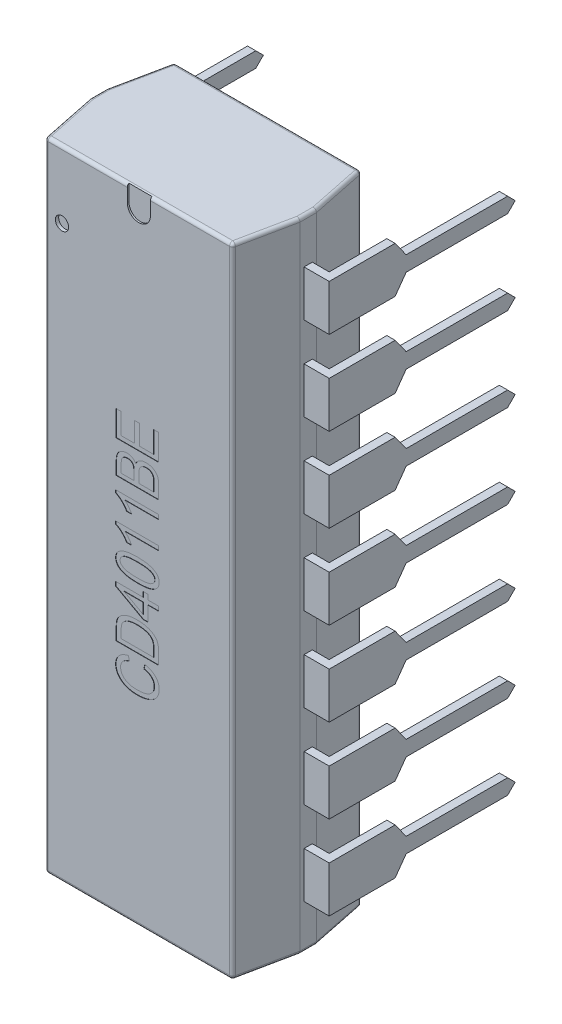
from build123d import *

# Parameters (mm, degrees)
IC_BODY_DEPTH              = 9.65
IC_BODY_DEPTH_BACK         = 9.65
FILLET6_R                  = 0.1
EXTRUDE_PINS_DEPTH         = 0.125
EXTRUDE_START              = -1.39
SKETCH32_W                 = 0.51
SKETCH32_H                 = 0.25
EXTRUDE_PINS_TO_BODY_DEPTH = 1.39
LPATTERN1_COUNT            = 4
LPATTERN1_PITCH            = 2.54
LPATTERN1_COL_COUNT        = 4
LPATTERN1_COL_PITCH        = 2.54
MIRROR1_START              = 3.685
MIRROR1_DEPTH              = 0.25
MIRROR1_START_2            = 3.175
MIRROR1_2_OUTLINE_W        = 1.39
MIRROR1_2_OUTLINE_H        = 0.25
MIRROR1_2_DEPTH            = 0.51
CUT_IC_LOCATOR_DEPTH       = 0.05
SKETCH24_R                 = 0.2
CUT_PIN_1_ID_DEPTH         = 0.1
CUT_NAME_DEPTH             = 0.01


# Read off the part's stored shape, not the designer's step: Mirror1
with BuildPart() as part:
    # Sketch11 → IC Body (new, two sides: drawn at the far end of the back side and taken through both)
    with BuildSketch(Plane(origin=(0, 0, 0), x_dir=(1, 0, 0), z_dir=(0, 1, 0)).offset(-IC_BODY_DEPTH_BACK)):
        Polygon((-2.825, 0), (2.825, 0), (3.175, -1.7), (3.175, -2.2), (2.825, -3.9), (-2.825, -3.9), (-3.175, -2.2), (-3.175, -1.7), align=None)
    extrude(amount=IC_BODY_DEPTH + IC_BODY_DEPTH_BACK)

    # Fillet6
    fillet6_edges = [part.edges().sort_by_distance(p)[0] for p in [
        (-3, -9.65, 3.05),
        (-2.825, 0, 0),
        (2.825, 0, 0),
        (2.825, 0, 3.9),
        (-2.825, 0, 3.9),
        (0, -9.65, 3.9),
        (3, -9.65, 3.05),
        (-3, 9.65, 0.85),
        (-3.175, 9.65, 1.95),
        (-3, 9.65, 3.05),
        (0, 9.65, 3.9),
        (3, 9.65, 3.05),
        (3.175, -9.65, 1.95),
        (3.175, 9.65, 1.95),
        (3, 9.65, 0.85),
        (0, 9.65, 0),
        (3, -9.65, 0.85),
        (0, -9.65, 0),
        (-3, -9.65, 0.85),
        (-3.175, -9.65, 1.95),
    ]]
    fillet(fillet6_edges, radius=FILLET6_R)



with BuildPart() as body_2:
    # Sketch31 → Extrude Pins (new, symmetric)
    with BuildSketch(Plane(origin=(-3.81, 0, 0), x_dir=(0, 0, -1), z_dir=(1, 0, 0))):
        Polygon((3.324, -0.23), (3.554, 0), (3.324, 0.23), (0.254, 0.23), (-0.079834708, 0.695), (-2.075, 0.695), (-2.075, -0.695), (-0.079834708, -0.695), (0.254, -0.23), align=None)
    extrude_pins = extrude(amount=EXTRUDE_PINS_DEPTH, both=True)


with BuildPart() as part_1:
    add(part.part)

    add(body_2.part)  # Extrude Pins to Body merges body 2
    # Sketch32 → Extrude Pins to Body (add)
    with BuildSketch(Plane(origin=(0, 0.695, 0), x_dir=(1, 0, 0), z_dir=(0, 1, 0)).offset(EXTRUDE_START)):
        with Locations((-3.43, -1.95)):
            Rectangle(SKETCH32_W, SKETCH32_H)
    extrude_pins_to_body = extrude(amount=EXTRUDE_PINS_TO_BODY_DEPTH)

    # LPattern1: Extrude Pins, Extrude Pins to Body ×4
    with Locations(*[(0, i * LPATTERN1_PITCH, 0) for i in range(1, LPATTERN1_COUNT)]):
        add(extrude_pins)
        add(extrude_pins_to_body)


with BuildPart() as lpattern1_col_1:
    # LPattern1 col: Extrude Pins, Extrude Pins to Body ×4
    with Locations(*[(0, -i * LPATTERN1_COL_PITCH, 0) for i in range(1, LPATTERN1_COL_COUNT)]):
        add(extrude_pins)
        add(extrude_pins_to_body)


with BuildPart() as part_2:
    add(part_1.part)

    # LPattern1 col united with what the copie: union LPattern1 col_1
    add(lpattern1_col_1.part)



with BuildPart() as body_2_2:
    # Mirror1 outline → Mirror1 (new body)
    with BuildSketch(Plane.YZ.offset(MIRROR1_START)):
        Polygon((-0.695, 2.075), (-0.695, 0.079834708), (-0.23, -0.254), (-0.23, -3.324), (0, -3.554), (0.23, -3.324), (0.23, -0.254), (0.695, 0.079834708), (0.695, 2.075), align=None)
        Polygon((1.845, 2.075), (1.845, 0.079834708), (2.31, -0.254), (2.31, -3.324), (2.54, -3.554), (2.77, -3.324), (2.77, -0.254), (3.235, 0.079834708), (3.235, 2.075), align=None)
        Polygon((4.385, 2.075), (4.385, 0.079834708), (4.85, -0.254), (4.85, -3.324), (5.08, -3.554), (5.31, -3.324), (5.31, -0.254), (5.775, 0.079834708), (5.775, 2.075), align=None)
        Polygon((6.925, 2.075), (6.925, 0.079834708), (7.39, -0.254), (7.39, -3.324), (7.62, -3.554), (7.85, -3.324), (7.85, -0.254), (8.315, 0.079834708), (8.315, 2.075), align=None)
        Polygon((-3.235, 2.075), (-3.235, 0.079834708), (-2.77, -0.254), (-2.77, -3.324), (-2.54, -3.554), (-2.31, -3.324), (-2.31, -0.254), (-1.845, 0.079834708), (-1.845, 2.075), align=None)
        Polygon((-5.775, 2.075), (-5.775, 0.079834708), (-5.31, -0.254), (-5.31, -3.324), (-5.08, -3.554), (-4.85, -3.324), (-4.85, -0.254), (-4.385, 0.079834708), (-4.385, 2.075), align=None)
        Polygon((-8.315, 2.075), (-8.315, 0.079834708), (-7.85, -0.254), (-7.85, -3.324), (-7.62, -3.554), (-7.39, -3.324), (-7.39, -0.254), (-6.925, 0.079834708), (-6.925, 2.075), align=None)
    extrude(amount=MIRROR1_DEPTH)


with BuildPart() as part_3:
    add(part_2.part)

    add(body_2_2.part)  # Mirror1 2 merges body 2 2
    # Mirror1 2 outline → Mirror1 2 (add)
    with BuildSketch(Plane.YZ.offset(MIRROR1_START_2)):
        with Locations((0, 1.95)):
            Rectangle(MIRROR1_2_OUTLINE_W, MIRROR1_2_OUTLINE_H)
        with Locations((2.54, 1.95)):
            Rectangle(MIRROR1_2_OUTLINE_W, MIRROR1_2_OUTLINE_H)
        with Locations((5.08, 1.95)):
            Rectangle(MIRROR1_2_OUTLINE_W, MIRROR1_2_OUTLINE_H)
        with Locations((7.62, 1.95)):
            Rectangle(MIRROR1_2_OUTLINE_W, MIRROR1_2_OUTLINE_H)
        with Locations((-2.54, 1.95)):
            Rectangle(MIRROR1_2_OUTLINE_W, MIRROR1_2_OUTLINE_H)
        with Locations((-5.08, 1.95)):
            Rectangle(MIRROR1_2_OUTLINE_W, MIRROR1_2_OUTLINE_H)
        with Locations((-7.62, 1.95)):
            Rectangle(MIRROR1_2_OUTLINE_W, MIRROR1_2_OUTLINE_H)
    extrude(amount=MIRROR1_2_DEPTH)

    # Sketch25 → Cut IC Locator (cut)
    with BuildSketch(Plane.XY.offset(3.9)):
        with BuildLine():
            Line((0.35, 9.65), (0.35, 9.15))
            ThreePointArc((0.35, 9.15), (0, 8.8), (-0.35, 9.15))
            Line((-0.35, 9.15), (-0.35, 9.65))
            Line((-0.35, 9.65), (0.35, 9.65))
        make_face()
    extrude(amount=-CUT_IC_LOCATOR_DEPTH, mode=Mode.SUBTRACT)

    # Sketch24 → Cut -Pin 1 ID (cut)
    with BuildSketch(Plane.XY.offset(3.9)):
        with Locations((-2.325, 7.62)):
            Circle(SKETCH24_R)
    extrude(amount=-CUT_PIN_1_ID_DEPTH, mode=Mode.SUBTRACT)

    # Sketch33 → Cut-Name (cut)
    # profile 1 of 8: a face of its own
    with BuildSketch(Plane.XY.offset(3.9)):
        with BuildLine():
            Line((0.14971036, -2.818479596), (0.183065149, -2.685060443))
            add(Edge.make_bspline(
                [(0.183065149, -2.685060443), (0.200745702, -2.68903692), (0.235215407, -2.696789391), (0.284792985, -2.711332284), (0.33080895, -2.728319249), (0.37341885, -2.747314027), (0.412630347, -2.768333236), (0.448260494, -2.791647118), (0.480612243, -2.816933138), (0.509170771, -2.844660527), (0.534731317, -2.873914989), (0.556559158, -2.905013534), (0.575347355, -2.937547144), (0.590373959, -2.971755831), (0.602253739, -3.007424753), (0.610454338, -3.044722508), (0.615948306, -3.083503888), (0.616432361, -3.10996723), (0.616677394, -3.123363206)],
                knots=[0, 0, 0, 0, 1.289353086, 2.513700628, 3.673385124, 4.777321585, 5.831023157, 6.835648429, 7.803886002, 8.748111141, 9.663929382, 10.564264807, 11.447463292, 12.332994627, 13.21843967, 14.118159583, 15.047395907, 16, 16, 16, 16], degree=3))
            add(Edge.make_bspline(
                [(0.616677394, -3.123363206), (0.616514252, -3.135186292), (0.616194456, -3.158362316), (0.612579368, -3.19246904), (0.607298818, -3.225346511), (0.599348989, -3.256918778), (0.589616268, -3.287254786), (0.577118555, -3.316063839), (0.562888374, -3.343805925), (0.546097345, -3.370193722), (0.527012812, -3.395379338), (0.505164934, -3.419225592), (0.480674449, -3.441891579), (0.453289847, -3.463204231), (0.423745844, -3.483910018), (0.391110949, -3.502888635), (0.355929234, -3.520814591), (0.318294468, -3.537649232), (0.278506753, -3.553213385), (0.23649911, -3.565945659), (0.192985075, -3.57729481), (0.147632306, -3.586303745), (0.100627861, -3.593736403), (0.051717012, -3.598443311), (0.001136438, -3.601770029), (-0.033214037, -3.602132715), (-0.050678953, -3.602317116)],
                knots=[0, 0, 0, 0, 0.921073667, 1.805520506, 2.670265093, 3.514196551, 4.340540458, 5.150330323, 5.958760814, 6.76821105, 7.584651584, 8.418448886, 9.285522186, 10.182088649, 11.121025464, 12.095129432, 13.121488672, 14.19720655, 15.30730909, 16.448576387, 17.61598683, 18.810867686, 20.050753221, 21.323199669, 22.639026301, 24, 24, 24, 24], degree=3))
            add(Edge.make_bspline(
                [(-0.050678953, -3.602317116), (-0.067883456, -3.602134221), (-0.101626853, -3.601775507), (-0.151166324, -3.598454226), (-0.198780315, -3.593759333), (-0.244305389, -3.586300352), (-0.287939695, -3.577353516), (-0.329392662, -3.566045029), (-0.369005956, -3.553128453), (-0.406398496, -3.537766722), (-0.441608115, -3.520464367), (-0.474752715, -3.501946085), (-0.505878284, -3.482337734), (-0.534421694, -3.460652854), (-0.560987111, -3.437958845), (-0.585141576, -3.413486523), (-0.60700832, -3.387642796), (-0.626934153, -3.360567656), (-0.644208406, -3.332201835), (-0.65954765, -3.303122517), (-0.672275402, -3.273113018), (-0.682734249, -3.242282312), (-0.690864233, -3.210660345), (-0.696453985, -3.178235163), (-0.700396577, -3.145088434), (-0.70068915, -3.122680103), (-0.700836737, -3.111376329)],
                knots=[0, 0, 0, 0, 1.355026576, 2.657629592, 3.909672378, 5.122282177, 6.289750101, 7.416737124, 8.50507279, 9.569838826, 10.598010427, 11.593540646, 12.559644741, 13.492918072, 14.414658006, 15.309728197, 16.19807831, 17.079418121, 17.954841938, 18.811754048, 19.667052977, 20.519555819, 21.374197669, 22.235876869, 23.110096619, 24, 24, 24, 24], degree=3))
            add(Edge.make_bspline(
                [(-0.700836737, -3.111376329), (-0.700519757, -3.099030074), (-0.699897101, -3.074777838), (-0.695462825, -3.038971723), (-0.687599706, -3.004633047), (-0.676788171, -2.971528718), (-0.663355508, -2.939651936), (-0.646484388, -2.909244351), (-0.626584831, -2.880196497), (-0.603579712, -2.852608771), (-0.577816375, -2.826480828), (-0.5489949, -2.802435137), (-0.517238455, -2.780553631), (-0.482906213, -2.760448876), (-0.445522325, -2.74269286), (-0.405409445, -2.72699134), (-0.362553626, -2.712587071), (-0.332609199, -2.705414975), (-0.317256673, -2.701737837)],
                knots=[0, 0, 0, 0, 0.96928357, 1.904001914, 2.82717962, 3.730829761, 4.635277328, 5.538798787, 6.456240452, 7.39579775, 8.3554607, 9.333438427, 10.337996414, 11.380185464, 12.453917498, 13.583566383, 14.761092973, 16, 16, 16, 16], degree=3))
            Line((-0.317256673, -2.701737837), (-0.283901885, -2.83515699))
            add(Edge.make_bspline(
                [(-0.283901885, -2.83515699), (-0.294706521, -2.838172534), (-0.315778807, -2.844053752), (-0.346045034, -2.854519547), (-0.374244766, -2.865966246), (-0.40045414, -2.878406605), (-0.424445723, -2.892259953), (-0.446415026, -2.907121394), (-0.466423209, -2.923016366), (-0.484048381, -2.940278729), (-0.499951211, -2.95833397), (-0.51357446, -2.977735356), (-0.524955425, -2.998321801), (-0.534522511, -3.019907276), (-0.541718666, -3.042559994), (-0.547019163, -3.066354443), (-0.550145667, -3.091227376), (-0.550540448, -3.108240609), (-0.55074019, -3.116848599)],
                knots=[0, 0, 0, 0, 1.274827499, 2.486296693, 3.637698816, 4.732866786, 5.781146847, 6.783409552, 7.745577291, 8.681189198, 9.583979081, 10.476943643, 11.369744444, 12.253932728, 13.156290603, 14.066553906, 15.021756508, 16, 16, 16, 16], degree=3))
            add(Edge.make_bspline(
                [(-0.55074019, -3.116848599), (-0.550110709, -3.13383907), (-0.548882374, -3.166993399), (-0.538664922, -3.214944621), (-0.522321676, -3.259560461), (-0.502710899, -3.293517983), (-0.483900954, -3.318695019), (-0.467820656, -3.336542223), (-0.44986607, -3.353341918), (-0.430222396, -3.369323568), (-0.408733899, -3.384341615), (-0.385240687, -3.398235231), (-0.360072433, -3.411145911), (-0.333107051, -3.423294445), (-0.304163168, -3.433873887), (-0.273360858, -3.443235538), (-0.240764903, -3.451342699), (-0.206308168, -3.457830823), (-0.170022223, -3.462664473), (-0.131872986, -3.466388396), (-0.091872771, -3.468388609), (-0.064578744, -3.468726095), (-0.050678953, -3.468897964)],
                knots=[0, 0, 0, 0, 1.477150824, 2.882435776, 4.245666297, 5.596604592, 6.276856516, 6.977993226, 7.683799496, 8.414501263, 9.17983833, 9.962775894, 10.787606784, 11.640228058, 12.534608525, 13.467077939, 14.440493086, 15.455932091, 16.516312958, 17.624894552, 18.790450687, 20, 20, 20, 20], degree=3))
            add(Edge.make_bspline(
                [(-0.050678953, -3.468897964), (-0.029825673, -3.468568383), (0.010620803, -3.467929136), (0.069362279, -3.46385305), (0.124144666, -3.456721705), (0.174785343, -3.446252884), (0.221447266, -3.433321668), (0.264148285, -3.417588842), (0.302709124, -3.398458041), (0.337209999, -3.376602013), (0.367626009, -3.352215836), (0.394126518, -3.325904625), (0.416440785, -3.297502325), (0.434994461, -3.267353896), (0.449028206, -3.235010442), (0.459293647, -3.200926091), (0.465383207, -3.164839417), (0.466175773, -3.140150739), (0.466580848, -3.127532554)],
                knots=[0, 0, 0, 0, 1.437104972, 2.787371166, 4.055570009, 5.241294904, 6.348053785, 7.389870239, 8.372351441, 9.308936623, 10.198930124, 11.053953419, 11.87666206, 12.682560998, 13.486679433, 14.299132302, 15.130700221, 16, 16, 16, 16], degree=3))
            add(Edge.make_bspline(
                [(0.466580848, -3.127532554), (0.46632261, -3.118138705), (0.465813725, -3.099627098), (0.462008948, -3.072337125), (0.456134785, -3.045935743), (0.44748038, -3.020512066), (0.43617476, -2.996218037), (0.42256998, -2.972918601), (0.406499892, -2.950601564), (0.388112513, -2.929308745), (0.367117969, -2.909357762), (0.343503885, -2.891110443), (0.31750492, -2.874395357), (0.288770865, -2.859833394), (0.257667132, -2.846812417), (0.223991461, -2.835355839), (0.187768887, -2.825702107), (0.162600539, -2.820925814), (0.14971036, -2.818479596)],
                knots=[0, 0, 0, 0, 0.928238582, 1.829195527, 2.718541612, 3.598220604, 4.477899596, 5.362883569, 6.261136532, 7.192387853, 8.139765768, 9.118675424, 10.13801499, 11.190128329, 12.298336808, 13.468533125, 14.703488264, 16, 16, 16, 16], degree=3))
        make_face()
    # profile 2 of 8: a face of its own
    with BuildSketch(Plane.XY.offset(3.9)):
        with BuildLine():
            Line((0.6, -2.501609109), (-0.684159342, -2.501609109))
            Line((-0.684159342, -2.501609109), (-0.684159342, -2.139657541))
            add(Edge.make_bspline(
                [(-0.684159342, -2.139657541), (-0.684162657, -2.128797874), (-0.684169104, -2.107677811), (-0.682695507, -2.077101612), (-0.680979994, -2.048504494), (-0.678442728, -2.021981859), (-0.674930103, -1.997417521), (-0.671312709, -1.974807405), (-0.666232944, -1.954332901), (-0.662322386, -1.94151112), (-0.660446173, -1.935359464)],
                knots=[0, 0, 0, 0, 1.26215185, 2.454654178, 3.557482523, 4.592303098, 5.550444389, 6.441834679, 7.252420792, 8, 8, 8, 8], degree=3))
            add(Edge.make_bspline(
                [(-0.660446173, -1.935359464), (-0.654722803, -1.920386722), (-0.643272019, -1.890430657), (-0.617888391, -1.848862851), (-0.586202277, -1.810578126), (-0.548459989, -1.775285512), (-0.504723187, -1.743645353), (-0.455757566, -1.715385552), (-0.401426308, -1.691285464), (-0.341960161, -1.670578707), (-0.276843026, -1.654208754), (-0.205975572, -1.642713393), (-0.129433721, -1.635608197), (-0.07649308, -1.634801692), (-0.049115447, -1.634384618)],
                knots=[0, 0, 0, 0, 0.79354552, 1.587651966, 2.401682948, 3.25188975, 4.142718826, 5.072875711, 6.050348573, 7.085635456, 8.191960566, 9.375234215, 10.642633045, 12, 12, 12, 12], degree=3))
            add(Edge.make_bspline(
                [(-0.049115447, -1.634384618), (-0.031305519, -1.634603981), (0.003729438, -1.635035503), (0.055206956, -1.637857436), (0.104679438, -1.642817832), (0.15201442, -1.649728422), (0.19727823, -1.658996418), (0.240509145, -1.66971624), (0.281594461, -1.682910319), (0.320576679, -1.697667736), (0.357230143, -1.713983704), (0.391147566, -1.731700038), (0.422279111, -1.750536039), (0.450841704, -1.770237227), (0.476432103, -1.791382809), (0.499207075, -1.813660209), (0.519509236, -1.836839496), (0.53675253, -1.861602376), (0.551810421, -1.887770314), (0.564813373, -1.915659455), (0.575825134, -1.94554857), (0.584530384, -1.977411211), (0.591633572, -2.011068913), (0.596529653, -2.046682034), (0.59936226, -2.084193391), (0.599784262, -2.10985916), (0.6, -2.122980147)],
                knots=[0, 0, 0, 0, 1.386274685, 2.727022628, 4.011297765, 5.255271911, 6.448626978, 7.606323575, 8.720335122, 9.805243236, 10.849378986, 11.841293546, 12.781660028, 13.680063108, 14.539671463, 15.36201935, 16.157697919, 16.934245542, 17.70660244, 18.505119706, 19.326522077, 20.182800412, 21.073872178, 22.002301983, 22.978726542, 24, 24, 24, 24], degree=3))
            Line((0.6, -2.122980147), (0.6, -2.501609109))
        make_face()
        with BuildLine():
            Line((0.449903453, -2.368189956), (0.449903453, -2.139136372))
            add(Edge.make_bspline(
                [(0.449903453, -2.139136372), (0.449745809, -2.12792746), (0.449440012, -2.106184656), (0.447305191, -2.074623293), (0.444077619, -2.045100863), (0.439077164, -2.017703964), (0.432923081, -1.992429809), (0.425365241, -1.96920454), (0.416258395, -1.948113869), (0.405767363, -1.928782206), (0.393548639, -1.911198253), (0.380065785, -1.894606112), (0.36442144, -1.879548745), (0.347535941, -1.865151999), (0.328892387, -1.851808863), (0.308557089, -1.839506069), (0.286280998, -1.828667406), (0.27074173, -1.822188072), (0.262803939, -1.818878289)],
                knots=[0, 0, 0, 0, 1.342409423, 2.603976618, 3.787321799, 4.897425276, 5.936990894, 6.900926501, 7.818910418, 8.68490097, 9.530402278, 10.380244758, 11.240970118, 12.126792963, 13.036248329, 13.983649039, 14.970004749, 16, 16, 16, 16], degree=3))
            add(Edge.make_bspline(
                [(0.262803939, -1.818878289), (0.251638514, -1.814768969), (0.229072334, -1.806463718), (0.193878332, -1.795911302), (0.156973757, -1.787638286), (0.118537287, -1.780053846), (0.078469748, -1.774901593), (0.036786863, -1.770498767), (-0.006528689, -1.768271752), (-0.035997414, -1.767961223), (-0.050939537, -1.76780377)],
                knots=[0, 0, 0, 0, 0.893151802, 1.805128209, 2.755850574, 3.731738016, 4.745334486, 5.787480394, 6.878141491, 8, 8, 8, 8], degree=3))
            add(Edge.make_bspline(
                [(-0.050939537, -1.76780377), (-0.06683976, -1.767917721), (-0.097794411, -1.768139561), (-0.142901659, -1.770896986), (-0.1853663, -1.774843262), (-0.225169686, -1.780964413), (-0.262464544, -1.788330906), (-0.29709157, -1.797719755), (-0.329187862, -1.808636194), (-0.358588547, -1.821387285), (-0.38543715, -1.835575119), (-0.410108548, -1.850356185), (-0.432341191, -1.866290312), (-0.452293286, -1.883223416), (-0.469733189, -1.901350473), (-0.48533055, -1.920021407), (-0.498227269, -1.940051948), (-0.505099544, -1.954136048), (-0.508525536, -1.961157307)],
                knots=[0, 0, 0, 0, 1.456797099, 2.836101316, 4.139746769, 5.363373783, 6.524762118, 7.621480013, 8.64848053, 9.628833388, 10.554507815, 11.429517694, 12.262272889, 13.058269727, 13.823796696, 14.564721123, 15.284479333, 16, 16, 16, 16], degree=3))
            add(Edge.make_bspline(
                [(-0.508525536, -1.961157307), (-0.51061366, -1.966250017), (-0.515007437, -1.976965969), (-0.520045177, -1.994539358), (-0.524558661, -2.014087816), (-0.527716886, -2.035814123), (-0.530655553, -2.059518317), (-0.532769959, -2.085421681), (-0.533634218, -2.113419703), (-0.533917003, -2.132795259), (-0.534062796, -2.142784552)],
                knots=[0, 0, 0, 0, 0.715292366, 1.505100173, 2.373764653, 3.322734101, 4.358121183, 5.480036167, 6.700803291, 8, 8, 8, 8], degree=3))
            Line((-0.534062796, -2.142784552), (-0.534062796, -2.368189956))
            Line((-0.534062796, -2.368189956), (0.449903453, -2.368189956))
        make_face(mode=Mode.SUBTRACT)
    # profile 3 of 8: a face of its own
    with BuildSketch(Plane.XY.offset(3.9)):
        Polygon((0.6, -1.084030614), (0.283129513, -1.084030614), (0.283129513, -1.534320253), (0.133032966, -1.534320253), (-0.700836737, -1.07647367), (-0.700836737, -0.950611461), (0.133032966, -0.950611461), (0.133032966, -0.800514915), (0.283129513, -0.800514915), (0.283129513, -0.950611461), (0.6, -0.950611461), align=None)
        Polygon((0.133032966, -1.084030614), (-0.44728823, -1.084030614), (0.133032966, -1.402725191), align=None, mode=Mode.SUBTRACT)
    # profile 4 of 8: a face of its own
    with BuildSketch(Plane.XY.offset(3.9)):
        with BuildLine():
            add(Edge.make_bspline(
                [(-0.041558503, -0.667095762), (-0.067796635, -0.666883924), (-0.118744777, -0.666472586), (-0.192639119, -0.662220578), (-0.261673467, -0.655515751), (-0.325752508, -0.646392091), (-0.384895114, -0.634064437), (-0.439244057, -0.619461043), (-0.488647088, -0.601735077), (-0.533144162, -0.581549444), (-0.572562211, -0.558643794), (-0.606777208, -0.532940635), (-0.636070299, -0.504808577), (-0.659836391, -0.473671209), (-0.67826556, -0.440005086), (-0.691441995, -0.403739832), (-0.699413802, -0.364904667), (-0.700356, -0.338102628), (-0.700836737, -0.324427431)],
                knots=[0, 0, 0, 0, 1.522177082, 2.955701814, 4.292601031, 5.54555501, 6.7088804, 7.795771162, 8.808034672, 9.750647735, 10.627079958, 11.44753433, 12.228026558, 12.97593222, 13.711165822, 14.446140298, 15.20717461, 16, 16, 16, 16], degree=3))
            add(Edge.make_bspline(
                [(-0.700836737, -0.324427431), (-0.700483669, -0.312232826), (-0.69978987, -0.288269658), (-0.692919777, -0.253474742), (-0.682678253, -0.220481118), (-0.667564347, -0.189768639), (-0.648320177, -0.160989801), (-0.624646455, -0.134486565), (-0.597047187, -0.109573161), (-0.576118208, -0.095387673), (-0.56533291, -0.088077487)],
                knots=[0, 0, 0, 0, 1.02455918, 2.013323352, 2.972239719, 3.92313388, 4.881632631, 5.875512573, 6.905191138, 8, 8, 8, 8], degree=3))
            add(Edge.make_bspline(
                [(-0.56533291, -0.088077487), (-0.55081948, -0.079590508), (-0.520637271, -0.06194094), (-0.470066045, -0.040873253), (-0.413508768, -0.023059423), (-0.350908726, -0.008198908), (-0.282134059, 0.002590641), (-0.207463758, 0.011002951), (-0.126574714, 0.015906337), (-0.070576895, 0.016414211), (-0.041558503, 0.016677394)],
                knots=[0, 0, 0, 0, 0.745752227, 1.550870435, 2.425309485, 3.376577511, 4.404263406, 5.514061028, 6.71177208, 8, 8, 8, 8], degree=3))
            add(Edge.make_bspline(
                [(-0.041558503, 0.016677394), (-0.01549392, 0.016466671), (0.035107366, 0.016057576), (0.108565647, 0.011787851), (0.177256887, 0.005108933), (0.241149455, -0.004070189), (0.300150656, -0.016278474), (0.35431424, -0.031092727), (0.403766279, -0.048342113), (0.448250129, -0.0686901), (0.487859343, -0.091519547), (0.522255341, -0.117047238), (0.551433388, -0.145276936), (0.575463396, -0.176129492), (0.593826682, -0.210023469), (0.607313769, -0.246286521), (0.61525805, -0.28534434), (0.616196888, -0.312230391), (0.616677394, -0.325990937)],
                knots=[0, 0, 0, 0, 1.514074965, 2.939396442, 4.273020662, 5.522618968, 6.687464393, 7.770909357, 8.782798299, 9.726643008, 10.608576586, 11.434138097, 12.208514389, 12.960468265, 13.696662544, 14.439073904, 15.201102606, 16, 16, 16, 16], degree=3))
            add(Edge.make_bspline(
                [(0.616677394, -0.325990937), (0.616216121, -0.338267652), (0.615309207, -0.362405056), (0.608427504, -0.397827003), (0.596525371, -0.431328369), (0.580280693, -0.463244214), (0.559047083, -0.49307995), (0.533549862, -0.521540039), (0.503097942, -0.547945716), (0.468126947, -0.573097745), (0.427335869, -0.595687063), (0.379918301, -0.614752945), (0.326035895, -0.631132866), (0.26530596, -0.644031397), (0.198108259, -0.654842784), (0.124116816, -0.661743249), (0.043535312, -0.666248515), (-0.012453016, -0.66680597), (-0.041558503, -0.667095762)],
                knots=[0, 0, 0, 0, 0.713852874, 1.403515076, 2.08903769, 2.775973907, 3.479633763, 4.213082677, 4.993526966, 5.819329379, 6.714934747, 7.698240864, 8.786642223, 9.986811405, 11.306714678, 12.743554856, 14.307139623, 16, 16, 16, 16], degree=3))
        make_face()
        with BuildLine():
            add(Edge.make_bspline(
                [(-0.042079671, -0.53367661), (-0.017061948, -0.533441371), (0.030816126, -0.532991179), (0.099399908, -0.530579338), (0.161462472, -0.525921327), (0.217128512, -0.519543536), (0.266394465, -0.511346956), (0.309358288, -0.501468566), (0.345766383, -0.489346634), (0.376254952, -0.475375243), (0.401582685, -0.459645012), (0.423420537, -0.443272246), (0.441888963, -0.425761216), (0.456910646, -0.4070605), (0.468868025, -0.387416092), (0.477273914, -0.366567546), (0.482450607, -0.34465892), (0.482986894, -0.329667474), (0.483258242, -0.322082173)],
                knots=[0, 0, 0, 0, 1.930680258, 3.694870612, 5.294765573, 6.732327541, 8.017244644, 9.14720992, 10.130763445, 10.973463911, 11.728776188, 12.427251247, 13.076760965, 13.687074849, 14.273357039, 14.844695938, 15.415444712, 16, 16, 16, 16], degree=3))
            add(Edge.make_bspline(
                [(0.483258242, -0.322082173), (0.483010713, -0.314923091), (0.482517844, -0.300668219), (0.476882593, -0.279884944), (0.468594694, -0.259865773), (0.456653918, -0.240815665), (0.440957253, -0.223158747), (0.422298802, -0.206085659), (0.400266945, -0.189971938), (0.374599531, -0.174585157), (0.343996212, -0.160472363), (0.307283333, -0.148827517), (0.264403821, -0.138816197), (0.215321622, -0.130539254), (0.159878362, -0.124599002), (0.098187281, -0.119814737), (0.03012044, -0.117437634), (-0.017322839, -0.116980368), (-0.042079671, -0.116741758)],
                knots=[0, 0, 0, 0, 0.556166894, 1.107416796, 1.665226727, 2.239567038, 2.848554421, 3.499699756, 4.205927923, 4.970429246, 5.826979258, 6.823810641, 7.964115301, 9.254120602, 10.697341843, 12.305131035, 14.071945012, 16, 16, 16, 16], degree=3))
            add(Edge.make_bspline(
                [(-0.042079671, -0.116741758), (-0.067097286, -0.11697898), (-0.115061946, -0.117433789), (-0.18373387, -0.119826021), (-0.245966697, -0.124517916), (-0.301725327, -0.130851439), (-0.351073288, -0.139075485), (-0.394043371, -0.148942688), (-0.43043322, -0.161092057), (-0.460909267, -0.174951307), (-0.4860077, -0.190886629), (-0.507949771, -0.207029015), (-0.525951007, -0.225017071), (-0.541173934, -0.243632271), (-0.553013189, -0.263545041), (-0.561486098, -0.284710825), (-0.566581738, -0.306986404), (-0.567137799, -0.322229859), (-0.567417584, -0.329899701)],
                knots=[0, 0, 0, 0, 1.925955125, 3.692509702, 5.288489091, 6.729174103, 8.01094651, 9.138146317, 10.1192927, 10.959930748, 11.707705856, 12.404471472, 13.052253553, 13.661073759, 14.251664904, 14.827808546, 15.410204315, 16, 16, 16, 16], degree=3))
            add(Edge.make_bspline(
                [(-0.567417584, -0.329899701), (-0.567177131, -0.337060418), (-0.566701185, -0.351234147), (-0.561034126, -0.371837728), (-0.552769227, -0.391620416), (-0.54071373, -0.41033007), (-0.525396025, -0.428123965), (-0.506780234, -0.445125639), (-0.484589286, -0.460907685), (-0.459042898, -0.476502722), (-0.428194349, -0.489977807), (-0.391693226, -0.502021819), (-0.348687053, -0.511504781), (-0.299574142, -0.519892187), (-0.244035188, -0.525812386), (-0.1823474, -0.530605786), (-0.114279559, -0.532980115), (-0.066836427, -0.533437787), (-0.042079671, -0.53367661)],
                knots=[0, 0, 0, 0, 0.557032304, 1.102574738, 1.655014845, 2.224515005, 2.830031617, 3.482190151, 4.185515023, 4.951205931, 5.812452911, 6.804401212, 7.944931852, 9.243623836, 10.689090768, 12.299381722, 14.068944907, 16, 16, 16, 16], degree=3))
        make_face(mode=Mode.SUBTRACT)
    # profile 5 of 8: a face of its own
    with BuildSketch(Plane.XY.offset(3.9)):
        with BuildLine():
            Line((0.6, 0.633740974), (0.6, 0.500321822))
            Line((0.6, 0.500321822), (-0.417321038, 0.500321822))
            add(Edge.make_bspline(
                [(-0.417321038, 0.500321822), (-0.407893022, 0.492124892), (-0.38835347, 0.475136763), (-0.360531034, 0.445752549), (-0.332166808, 0.412717193), (-0.304284295, 0.376472809), (-0.277727962, 0.339297076), (-0.253945401, 0.302865119), (-0.233607858, 0.268001223), (-0.22251633, 0.244678573), (-0.217192309, 0.233483517)],
                knots=[0, 0, 0, 0, 0.892632118, 1.84997915, 2.889208393, 4.004565423, 5.117638514, 6.154471911, 7.114131986, 8, 8, 8, 8], degree=3))
            Line((-0.217192309, 0.233483517), (-0.367288855, 0.233483517))
            add(Edge.make_bspline(
                [(-0.367288855, 0.233483517), (-0.378123809, 0.25147586), (-0.399700939, 0.287306483), (-0.437034764, 0.337619065), (-0.477644642, 0.384892107), (-0.521335425, 0.428125237), (-0.566176156, 0.467005773), (-0.611139707, 0.500146917), (-0.655535019, 0.52740715), (-0.686082098, 0.540771727), (-0.700836737, 0.547226993)],
                knots=[0, 0, 0, 0, 1.082336866, 2.155405958, 3.2255179, 4.292702086, 5.32152541, 6.282639852, 7.170492597, 8, 8, 8, 8], degree=3))
            Line((-0.700836737, 0.547226993), (-0.700836737, 0.633740974))
            Line((-0.700836737, 0.633740974), (0.6, 0.633740974))
        make_face()
    # profile 6 of 8: a face of its own
    with BuildSketch(Plane.XY.offset(3.9)):
        with BuildLine():
            Line((0.6, 1.450933283), (0.6, 1.317514131))
            Line((0.6, 1.317514131), (-0.417321038, 1.317514131))
            add(Edge.make_bspline(
                [(-0.417321038, 1.317514131), (-0.407893022, 1.309317201), (-0.38835347, 1.292329072), (-0.360531034, 1.262944857), (-0.332166808, 1.229909502), (-0.304284295, 1.193665118), (-0.277727962, 1.156489384), (-0.253945401, 1.120057428), (-0.233607858, 1.085193532), (-0.22251633, 1.061870881), (-0.217192309, 1.050675826)],
                knots=[0, 0, 0, 0, 0.892632118, 1.84997915, 2.889208393, 4.004565423, 5.117638514, 6.154471911, 7.114131986, 8, 8, 8, 8], degree=3))
            Line((-0.217192309, 1.050675826), (-0.367288855, 1.050675826))
            add(Edge.make_bspline(
                [(-0.367288855, 1.050675826), (-0.378123809, 1.068668169), (-0.399700939, 1.104498792), (-0.437034764, 1.154811374), (-0.477644642, 1.202084416), (-0.521335425, 1.245317546), (-0.566176156, 1.284198082), (-0.611139707, 1.317339226), (-0.655535019, 1.344599459), (-0.686082098, 1.357964036), (-0.700836737, 1.364419301)],
                knots=[0, 0, 0, 0, 1.082336866, 2.155405958, 3.2255179, 4.292702086, 5.32152541, 6.282639852, 7.170492597, 8, 8, 8, 8], degree=3))
            Line((-0.700836737, 1.364419301), (-0.700836737, 1.450933283))
            Line((-0.700836737, 1.450933283), (0.6, 1.450933283))
        make_face()
    # profile 7 of 8: a face of its own
    with BuildSketch(Plane.XY.offset(3.9)):
        with BuildLine():
            Line((0.6, 1.834513346), (-0.684159342, 1.834513346))
            Line((-0.684159342, 1.834513346), (-0.684159342, 2.232686129))
            add(Edge.make_bspline(
                [(-0.684159342, 2.232686129), (-0.684089051, 2.242504815), (-0.683952069, 2.261639255), (-0.68202989, 2.289544527), (-0.679199155, 2.3158892), (-0.67540295, 2.340719857), (-0.670166633, 2.363849352), (-0.663940832, 2.385481289), (-0.656377203, 2.405489834), (-0.645007132, 2.430154734), (-0.627167765, 2.458577117), (-0.601071401, 2.48964567), (-0.569127559, 2.516766529), (-0.533236752, 2.540884723), (-0.493628523, 2.560655561), (-0.451349928, 2.57474497), (-0.406986926, 2.583373989), (-0.37670905, 2.584448881), (-0.361295417, 2.584996079)],
                knots=[0, 0, 0, 0, 0.870718414, 1.69683706, 2.47956926, 3.220541843, 3.923321261, 4.581574042, 5.215481129, 5.818681375, 6.98813212, 8.179780617, 9.403183136, 10.691662615, 12.00782999, 13.316126887, 14.633714065, 16, 16, 16, 16], degree=3))
            add(Edge.make_bspline(
                [(-0.361295417, 2.584996079), (-0.347106747, 2.584563325), (-0.31924344, 2.583713496), (-0.278618396, 2.57649684), (-0.240154615, 2.564756536), (-0.204162445, 2.548205191), (-0.170710521, 2.527781971), (-0.1407636, 2.502933665), (-0.114006924, 2.474404768), (-0.09946587, 2.452667942), (-0.092111853, 2.441674724)],
                knots=[0, 0, 0, 0, 1.067081852, 2.095504945, 3.094144713, 4.085742949, 5.068946461, 6.03476578, 7.006099196, 8, 8, 8, 8], degree=3))
            add(Edge.make_bspline(
                [(-0.092111853, 2.441674724), (-0.085958101, 2.454872486), (-0.073704392, 2.481152638), (-0.047314172, 2.516043438), (-0.015168353, 2.546560893), (0.022845775, 2.572216752), (0.066006191, 2.593233683), (0.11426754, 2.607933241), (0.167093126, 2.616930121), (0.203873921, 2.617865917), (0.222934544, 2.618350867)],
                knots=[0, 0, 0, 0, 0.907964335, 1.807991438, 2.714152788, 3.66722719, 4.662631151, 5.703092551, 6.80969165, 8, 8, 8, 8], degree=3))
            add(Edge.make_bspline(
                [(0.222934544, 2.618350867), (0.242080812, 2.61785781), (0.279289071, 2.616899619), (0.333294591, 2.607802632), (0.383636583, 2.592983934), (0.43002214, 2.572514259), (0.471353539, 2.547008365), (0.507588341, 2.517694526), (0.537175748, 2.483750516), (0.557034602, 2.452220204), (0.569363644, 2.424688115), (0.577851802, 2.402316363), (0.584364128, 2.37797981), (0.590287554, 2.35194343), (0.594573815, 2.323982615), (0.597589528, 2.294146119), (0.599870724, 2.262601161), (0.599956137, 2.240942389), (0.6, 2.229819702)],
                knots=[0, 0, 0, 0, 1.483468145, 2.882925605, 4.231751595, 5.543275311, 6.8011365, 7.987654169, 9.142598007, 10.276937419, 10.861609843, 11.479582699, 12.129918667, 12.812910486, 13.549205422, 14.321194287, 15.137862906, 16, 16, 16, 16], degree=3))
            Line((0.6, 2.229819702), (0.6, 1.834513346))
        make_face()
        with BuildLine():
            Line((-0.150482733, 1.967932499), (-0.150482733, 2.20350069))
            add(Edge.make_bspline(
                [(-0.150482733, 2.20350069), (-0.150585822, 2.217753902), (-0.150776454, 2.244110852), (-0.153260831, 2.280250041), (-0.156192639, 2.310039762), (-0.160723928, 2.327225874), (-0.162730194, 2.334835168)],
                knots=[0, 0, 0, 0, 1.292436319, 2.38996507, 3.287143691, 4, 4, 4, 4], degree=3))
            add(Edge.make_bspline(
                [(-0.162730194, 2.334835168), (-0.165902977, 2.343746322), (-0.172101148, 2.361154648), (-0.186307023, 2.384448342), (-0.203010761, 2.40502948), (-0.223476937, 2.421802144), (-0.24721272, 2.435526704), (-0.274894823, 2.444949809), (-0.306331186, 2.450746124), (-0.328520854, 2.451290628), (-0.34018809, 2.451576926)],
                knots=[0, 0, 0, 0, 0.985805945, 1.925814679, 2.834417788, 3.743020897, 4.673874055, 5.684144792, 6.782332848, 8, 8, 8, 8], degree=3))
            add(Edge.make_bspline(
                [(-0.34018809, 2.451576926), (-0.351147971, 2.451202824), (-0.372145237, 2.450486106), (-0.402399882, 2.44570346), (-0.429603349, 2.436697384), (-0.454025385, 2.424837382), (-0.475046512, 2.409830369), (-0.492804577, 2.392466721), (-0.507074864, 2.372684731), (-0.516027716, 2.35410933), (-0.52106748, 2.337285463), (-0.524812634, 2.322461332), (-0.52749425, 2.305265159), (-0.529765341, 2.285870865), (-0.531984271, 2.264256223), (-0.533118257, 2.240252986), (-0.533935958, 2.214016844), (-0.534019462, 2.19577085), (-0.534062796, 2.186302127)],
                knots=[0, 0, 0, 0, 1.374778969, 2.633842435, 3.825843143, 4.956159927, 6.02628444, 7.050855484, 8.057665484, 9.071230899, 9.619088352, 10.258510643, 10.987442123, 11.799549317, 12.707953811, 13.711694261, 14.812488201, 16, 16, 16, 16], degree=3))
            Line((-0.534062796, 2.186302127), (-0.534062796, 1.967932499))
            Line((-0.534062796, 1.967932499), (-0.150482733, 1.967932499))
        make_face(mode=Mode.SUBTRACT)
        with BuildLine():
            Line((0.449903453, 1.967932499), (0.449903453, 2.232686129))
            add(Edge.make_bspline(
                [(0.449903453, 2.232686129), (0.449703463, 2.246329527), (0.449330992, 2.271739571), (0.446675954, 2.30702961), (0.441854286, 2.336720159), (0.436273605, 2.35407802), (0.433747228, 2.361935933)],
                knots=[0, 0, 0, 0, 1.250964288, 2.329849019, 3.243921745, 4, 4, 4, 4], degree=3))
            add(Edge.make_bspline(
                [(0.433747228, 2.361935933), (0.429565622, 2.371585175), (0.421407112, 2.3904113), (0.403629442, 2.415262083), (0.382614411, 2.436805216), (0.35747737, 2.454251668), (0.328967212, 2.468254251), (0.296957579, 2.478040688), (0.261529764, 2.483737831), (0.236854263, 2.484522316), (0.223976881, 2.484931715)],
                knots=[0, 0, 0, 0, 0.968261875, 1.88912469, 2.801889462, 3.733923069, 4.698460079, 5.722946274, 6.811675982, 8, 8, 8, 8], degree=3))
            add(Edge.make_bspline(
                [(0.223976881, 2.484931715), (0.212049599, 2.484636241), (0.18900125, 2.484065266), (0.155919827, 2.478141608), (0.125546653, 2.468933818), (0.098346632, 2.455487215), (0.074343199, 2.439114993), (0.053557918, 2.420021198), (0.03624177, 2.398279906), (0.024734038, 2.377830732), (0.017541621, 2.359682342), (0.012432117, 2.344262617), (0.008839633, 2.326818437), (0.005318924, 2.30773349), (0.00277428, 2.286847136), (0.001083116, 2.264149266), (-0.000403435, 2.23965375), (-0.000392069, 2.222699645), (-0.000386186, 2.213924061)],
                knots=[0, 0, 0, 0, 1.410959147, 2.726545491, 3.96598681, 5.157380833, 6.304254745, 7.396074949, 8.486780283, 9.582710814, 10.159527789, 10.797066246, 11.503257763, 12.265916193, 13.095164103, 13.992899173, 14.961108084, 16, 16, 16, 16], degree=3))
            Line((-0.000386186, 2.213924061), (-0.000386186, 1.967932499))
            Line((-0.000386186, 1.967932499), (0.449903453, 1.967932499))
        make_face(mode=Mode.SUBTRACT)
    # profile 8 of 8: a face of its own
    with BuildSketch(Plane.XY.offset(3.9)):
        Polygon((0.6, 2.818479596), (-0.684159342, 2.818479596), (-0.684159342, 3.585639722), (-0.534062796, 3.585639722), (-0.534062796, 2.951898748), (-0.133805339, 2.951898748), (-0.133805339, 3.552284934), (0.016291208, 3.552284934), (0.016291208, 2.951898748), (0.449903453, 2.951898748), (0.449903453, 3.602317116), (0.6, 3.602317116), align=None)
    extrude(amount=-CUT_NAME_DEPTH, mode=Mode.SUBTRACT)


solid = part_3.part
